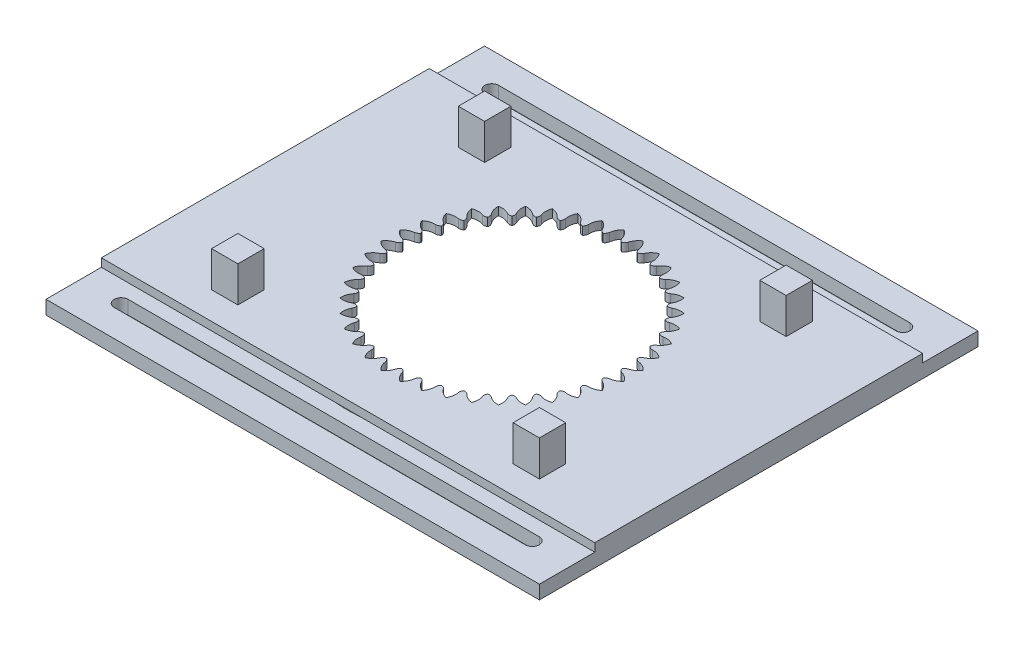
from build123d import *

# Parameters (mm, degrees)
SKETCH1_W                = 228.6
SKETCH1_H                = 203.2
BOSS_EXTRUDE1_DEPTH      = 10.16
SKETCH3_W                = 12.192
SKETCH3_H                = 12.192
BOSS_EXTRUDE2_DEPTH      = 16.51
SKETCH4_R                = 56.67375
CUT_EXTRUDE3_DEPTH       = 154.816871961
BOSS_EXTRUDE3_DEPTH      = 10.16
FILLET1_R                = 2.54
CIRPATTERN3_COUNT        = 40
FILLET1_OF_CIRPATTERN3_R = 2.54
CUT_EXTRUDE4_DEPTH       = 154.816871961
SKETCH10_R               = 76.2
CUT_EXTRUDE5_DEPTH       = 6.35
SKETCH12_W               = 228.6
SKETCH12_H               = 25.654
CUT_EXTRUDE6_DEPTH       = 3.81


with BuildPart() as part:
    # Sketch1 → Boss-Extrude1 (new body)
    with BuildSketch(Plane(origin=(0, 0, 0), x_dir=(1, 0, 0), z_dir=(0, 1, 0))):
        Rectangle(SKETCH1_W, SKETCH1_H)
    extrude(amount=BOSS_EXTRUDE1_DEPTH)

    # Sketch3 → Boss-Extrude2 (add)
    with BuildSketch(Plane(origin=(0, 10.16, 0), x_dir=(1, 0, 0), z_dir=(0, 1, 0))):
        with Locations((-69.85, -57.15)):
            Rectangle(SKETCH3_W, SKETCH3_H)
        with Locations((-69.85, 57.15)):
            Rectangle(SKETCH3_W, SKETCH3_H)
        with Locations((69.85, 57.15)):
            Rectangle(SKETCH3_W, SKETCH3_H)
        with Locations((69.85, -57.15)):
            Rectangle(SKETCH3_W, SKETCH3_H)
    extrude(amount=BOSS_EXTRUDE2_DEPTH)

    # Sketch4 → Cut-Extrude3 (cut, through all)
    with BuildSketch(Plane(origin=(0, 10.16, 0), x_dir=(1, 0, 0), z_dir=(0, 1, 0))):
        with Locations(Location((0, 0, 0), (0, 0, 270))):
            Circle(SKETCH4_R)
    extrude(amount=-CUT_EXTRUDE3_DEPTH, mode=Mode.SUBTRACT)

    # Sketch6 → Boss-Extrude3 (add)
    with BuildSketch(Plane(origin=(0, 10.16, 0), x_dir=(1, 0, 0), z_dir=(0, 1, 0))):
        with BuildLine():
            ThreePointArc((-1.180629156, 50.587787481), (-2.78438225, 54.891829112), (-6.706294718, 57.282519587))
            ThreePointArc((-6.706294718, 57.282519587), (0, 57.67375), (6.706294718, 57.282519587))
            ThreePointArc((6.706294718, 57.282519587), (2.78438225, 54.891829112), (1.180629156, 50.587787481))
            ThreePointArc((1.180629156, 50.587787481), (0, 50.6015625), (-1.180629156, 50.587787481))
        make_face()
    boss_extrude3 = extrude(amount=-BOSS_EXTRUDE3_DEPTH)

    # Fillet1
    # the kernel refuses this fillet: 2.54 mm, written as the material it takes off along each edge
    with BuildSketch(Plane(origin=(1.180629156, 15.419408995, -50.587787481), x_dir=(0.15469840037733465, 0, -0.9879617426402167), z_dir=(0, -1, 0))) as fillet1_piece_1:
        with BuildLine():
            CenterArc((2.181678609, -2.517907582), FILLET1_R, 97.562365803, 72.493020651)
            ThreePointArc((-0.320158283, -2.079259471), (-0.149272304, -1.041293741), (0, 0))
            ThreePointArc((0, 0), (0.923700585, -0.061047431), (1.84740117, 0))
        make_face()
    extrude(amount=20.678817989, mode=Mode.SUBTRACT)
    with BuildSketch(Plane(origin=(-1.180629156, 15.419408995, -50.587787481), x_dir=(-0.15469840037733582, 0, -0.9879617426402166), z_dir=(0, -1, 0))) as fillet1_piece_2:
        with BuildLine():
            CenterArc((2.181678609, 2.517907582), FILLET1_R, 189.944613546, 72.493020651)
            ThreePointArc((-0.320158283, 2.079259471), (-0.149272304, 1.041293741), (0, 0))
            ThreePointArc((0, 0), (0.923700585, 0.061047431), (1.84740117, 0))
        make_face()
    extrude(amount=20.678817989, mode=Mode.SUBTRACT)

    # CirPattern3: Boss-Extrude3 ×40 about axis
    cirpattern3_axis = Axis((0, 0, 0), (0, 1, 0))
    for i in range(1, CIRPATTERN3_COUNT):
        add(boss_extrude3.rotate(cirpattern3_axis, i * 360 / CIRPATTERN3_COUNT))

    # Fillet1 of CirPattern3
    # the kernel refuses this fillet: 2.54 mm, written as the material it takes off along each edge
    with BuildSketch(Plane(origin=(-6.747579821, 15.419408995, -50.149658962), x_dir=(-0.0017574603287242576, 0, -0.999998455665404), z_dir=(0, -1, 0)), Plane(origin=(-14.509640988, 15.419408995, -48.476679402), x_dir=(-0.1581700465288128, 0, -0.9874118879075101), z_dir=(0, -1, 0)), Plane(origin=(-21.914426639, 15.419408995, -45.61004311), x_dir=(-0.31068796124707543, 0, -0.9505119624371572), z_dir=(0, -1, 0)), Plane(origin=(-28.779606377, 15.419408995, -41.620336186), x_dir=(-0.45555570724520694, 0, -0.8902072778832575), z_dir=(0, -1, 0)), Plane(origin=(-34.936136691, 15.419408995, -36.605798455), x_dir=(-0.5892061598282523, 0, -0.8079827357193), z_dir=(0, -1, 0)), Plane(origin=(-40.232423374, 15.419408995, -30.689904478), x_dir=(-0.7083484012931893, 0, -0.7058629770609752), z_dir=(0, -1, 0)), Plane(origin=(-44.53805427, 15.419408995, -24.0183232), x_dir=(-0.8100487542447273, 0, -0.5863625292824953), z_dir=(0, -1, 0)), Plane(origin=(-47.747010456, 15.419408995, -16.755331091), x_dir=(-0.8918030184690784, 0, -0.452423890007414), z_dir=(0, -1, 0)), Plane(origin=(-49.780276781, 15.419408995, -9.079767124), x_dir=(-0.951598132654188, 0, -0.30734507305154973), z_dir=(0, -1, 0)), Plane(origin=(-50.587787481, 15.419408995, -1.180629156), x_dir=(-0.9879617426402166, 0, -0.15469840037733545), z_dir=(0, -1, 0)), Plane(origin=(-50.149658962, 15.419408995, 6.747579821), x_dir=(-0.9999984556654039, 0, 0.001757460328724237), z_dir=(0, -1, 0)), Plane(origin=(-48.476679402, 15.419408995, 14.509640988), x_dir=(-0.9874118879075098, 0, 0.15817004652881428), z_dir=(0, -1, 0)), Plane(origin=(-45.61004311, 15.419408995, 21.914426639), x_dir=(-0.9505119624371574, 0, 0.31068796124707493), z_dir=(0, -1, 0)), Plane(origin=(-41.620336186, 15.419408995, 28.779606377), x_dir=(-0.8902072778832575, 0, 0.455555707245207), z_dir=(0, -1, 0)), Plane(origin=(-36.605798455, 15.419408995, 34.936136691), x_dir=(-0.8079827357193022, 0, 0.5892061598282491), z_dir=(0, -1, 0)), Plane(origin=(-30.689904478, 15.419408995, 40.232423374), x_dir=(-0.7058629770609723, 0, 0.7083484012931922), z_dir=(0, -1, 0)), Plane(origin=(-24.0183232, 15.419408995, 44.53805427), x_dir=(-0.5863625292824933, 0, 0.8100487542447288), z_dir=(0, -1, 0)), Plane(origin=(-16.755331091, 15.419408995, 47.747010456), x_dir=(-0.452423890007414, 0, 0.8918030184690784), z_dir=(0, -1, 0)), Plane(origin=(-9.079767124, 15.419408995, 49.780276781), x_dir=(-0.3073450730515485, 0, 0.9515981326541885), z_dir=(0, -1, 0)), Plane(origin=(-1.180629156, 15.419408995, 50.587787481), x_dir=(-0.15469840037733626, 0, 0.9879617426402164), z_dir=(0, -1, 0)), Plane(origin=(6.747579821, 15.419408995, 50.149658962), x_dir=(0.0017574603287247316, 0, 0.999998455665404), z_dir=(0, -1, 0)), Plane(origin=(14.509640988, 15.419408995, 48.476679402), x_dir=(0.15817004652881494, 0, 0.9874118879075097), z_dir=(0, -1, 0)), Plane(origin=(21.914426639, 15.419408995, 45.61004311), x_dir=(0.310687961247076, 0, 0.950511962437157), z_dir=(0, -1, 0)), Plane(origin=(28.779606377, 15.419408995, 41.620336186), x_dir=(0.45555570724520844, 0, 0.8902072778832567), z_dir=(0, -1, 0)), Plane(origin=(34.936136691, 15.419408995, 36.605798455), x_dir=(0.5892061598282523, 0, 0.8079827357193), z_dir=(0, -1, 0)), Plane(origin=(40.232423374, 15.419408995, 30.689904478), x_dir=(0.7083484012931912, 0, 0.7058629770609732), z_dir=(0, -1, 0)), Plane(origin=(44.53805427, 15.419408995, 24.0183232), x_dir=(0.8100487542447268, 0, 0.586362529282496), z_dir=(0, -1, 0)), Plane(origin=(47.747010456, 15.419408995, 16.755331091), x_dir=(0.8918030184690776, 0, 0.45242389000741556), z_dir=(0, -1, 0)), Plane(origin=(49.780276781, 15.419408995, 9.079767124), x_dir=(0.9515981326541886, 0, 0.30734507305154785), z_dir=(0, -1, 0)), Plane(origin=(50.587787481, 15.419408995, 1.180629156), x_dir=(0.9879617426402165, 0, 0.1546984003773363), z_dir=(0, -1, 0)), Plane(origin=(50.149658962, 15.419408995, -6.747579821), x_dir=(0.9999984556654039, 0, -0.001757460328725693), z_dir=(0, -1, 0)), Plane(origin=(48.476679402, 15.419408995, -14.509640988), x_dir=(0.98741188790751, 0, -0.15817004652881245), z_dir=(0, -1, 0)), Plane(origin=(45.61004311, 15.419408995, -21.914426639), x_dir=(0.9505119624371569, 0, -0.3106879612470766), z_dir=(0, -1, 0)), Plane(origin=(41.620336186, 15.419408995, -28.779606377), x_dir=(0.8902072778832566, 0, -0.4555557072452085), z_dir=(0, -1, 0)), Plane(origin=(36.605798455, 15.419408995, -34.936136691), x_dir=(0.8079827357193, 0, -0.5892061598282523), z_dir=(0, -1, 0)), Plane(origin=(30.689904478, 15.419408995, -40.232423374), x_dir=(0.7058629770609732, 0, -0.7083484012931912), z_dir=(0, -1, 0)), Plane(origin=(24.0183232, 15.419408995, -44.53805427), x_dir=(0.5863625292824961, 0, -0.8100487542447269), z_dir=(0, -1, 0)), Plane(origin=(16.755331091, 15.419408995, -47.747010456), x_dir=(0.4524238900074171, 0, -0.8918030184690767), z_dir=(0, -1, 0)), Plane(origin=(9.079767124, 15.419408995, -49.780276781), x_dir=(0.30734507305155107, 0, -0.9515981326541875), z_dir=(0, -1, 0))) as fillet1_of_cirpattern3_piece_1:
        with BuildLine():
            CenterArc((2.181678609, -2.517907582), FILLET1_OF_CIRPATTERN3_R, 97.562365803, 72.493020651)
            ThreePointArc((-0.320158283, -2.079259471), (-0.149272304, -1.041293741), (0, 0))
            ThreePointArc((0, 0), (0.923700585, -0.061047431), (1.84740117, 0))
        make_face()
    extrude(amount=20.678817989, mode=Mode.SUBTRACT)
    with BuildSketch(Plane(origin=(-9.079767124, 15.419408995, -49.780276781), x_dir=(0.9872870237318744, 0, -0.15894757868762094), z_dir=(0, -1, 0)), Plane(origin=(-16.755331091, 15.419408995, -47.747010456), x_dir=(0.9502670027194106, 0, -0.3114363876342456), z_dir=(0, -1, 0)), Plane(origin=(-24.0183232, 15.419408995, -44.53805427), x_dir=(0.889848254344624, 0, -0.4562565991192077), z_dir=(0, -1, 0)), Plane(origin=(-30.689904478, 15.419408995, -40.232423374), x_dir=(0.8075184887108334, 0, -0.5898422589050155), z_dir=(0, -1, 0)), Plane(origin=(-36.605798455, 15.419408995, -34.936136691), x_dir=(0.7053049378847692, 0, -0.7089040447023573), z_dir=(0, -1, 0)), Plane(origin=(-41.620336186, 15.419408995, -28.779606377), x_dir=(0.5857244387150939, 0, -0.8105102602014908), z_dir=(0, -1, 0)), Plane(origin=(-45.61004311, 15.419408995, -21.914426639), x_dir=(0.451721459956291, 0, -0.8921590231651289), z_dir=(0, -1, 0)), Plane(origin=(-48.476679402, 15.419408995, -14.509640988), x_dir=(0.3065955996757912, 0, -0.9518398700723992), z_dir=(0, -1, 0)), Plane(origin=(-50.149658962, 15.419408995, -6.747579821), x_dir=(0.15392033819881498, 0, -0.9880832604030706), z_dir=(0, -1, 0)), Plane(origin=(-50.587787481, 15.419408995, 1.180629156), x_dir=(-0.0025449528369287443, 0, -0.9999967616022852), z_dir=(0, -1, 0)), Plane(origin=(-49.780276781, 15.419408995, 9.079767124), x_dir=(-0.15894757868762113, 0, -0.9872870237318744), z_dir=(0, -1, 0)), Plane(origin=(-47.747010456, 15.419408995, 16.755331091), x_dir=(-0.3114363876342477, 0, -0.9502670027194097), z_dir=(0, -1, 0)), Plane(origin=(-44.53805427, 15.419408995, 24.0183232), x_dir=(-0.4562565991192077, 0, -0.889848254344624), z_dir=(0, -1, 0)), Plane(origin=(-40.232423374, 15.419408995, 30.689904478), x_dir=(-0.5898422589050147, 0, -0.8075184887108341), z_dir=(0, -1, 0)), Plane(origin=(-34.936136691, 15.419408995, 36.605798455), x_dir=(-0.708904044702359, 0, -0.7053049378847674), z_dir=(0, -1, 0)), Plane(origin=(-28.779606377, 15.419408995, 41.620336186), x_dir=(-0.8105102602014898, 0, -0.5857244387150953), z_dir=(0, -1, 0)), Plane(origin=(-21.914426639, 15.419408995, 45.61004311), x_dir=(-0.8921590231651275, 0, -0.4517214599562937), z_dir=(0, -1, 0)), Plane(origin=(-14.509640988, 15.419408995, 48.476679402), x_dir=(-0.9518398700723981, 0, -0.3065955996757945), z_dir=(0, -1, 0)), Plane(origin=(-6.747579821, 15.419408995, 50.149658962), x_dir=(-0.9880832604030708, 0, -0.15392033819881487), z_dir=(0, -1, 0)), Plane(origin=(1.180629156, 15.419408995, 50.587787481), x_dir=(-0.9999967616022855, 0, 0.0025449528369287434), z_dir=(0, -1, 0)), Plane(origin=(9.079767124, 15.419408995, 49.780276781), x_dir=(-0.9872870237318744, 0, 0.158947578687621), z_dir=(0, -1, 0)), Plane(origin=(16.755331091, 15.419408995, 47.747010456), x_dir=(-0.9502670027194102, 0, 0.311436387634246), z_dir=(0, -1, 0)), Plane(origin=(24.0183232, 15.419408995, 44.53805427), x_dir=(-0.8898482543446238, 0, 0.4562565991192082), z_dir=(0, -1, 0)), Plane(origin=(30.689904478, 15.419408995, 40.232423374), x_dir=(-0.8075184887108331, 0, 0.5898422589050161), z_dir=(0, -1, 0)), Plane(origin=(36.605798455, 15.419408995, 34.936136691), x_dir=(-0.7053049378847673, 0, 0.708904044702359), z_dir=(0, -1, 0)), Plane(origin=(41.620336186, 15.419408995, 28.779606377), x_dir=(-0.5857244387150936, 0, 0.810510260201491), z_dir=(0, -1, 0)), Plane(origin=(45.61004311, 15.419408995, 21.914426639), x_dir=(-0.451721459956291, 0, 0.8921590231651289), z_dir=(0, -1, 0)), Plane(origin=(48.476679402, 15.419408995, 14.509640988), x_dir=(-0.3065955996757912, 0, 0.9518398700723992), z_dir=(0, -1, 0)), Plane(origin=(50.149658962, 15.419408995, 6.747579821), x_dir=(-0.15392033819881487, 0, 0.9880832604030708), z_dir=(0, -1, 0)), Plane(origin=(50.587787481, 15.419408995, -1.180629156), x_dir=(0.0025449528369287434, 0, 0.9999967616022855), z_dir=(0, -1, 0)), Plane(origin=(49.780276781, 15.419408995, -9.079767124), x_dir=(0.15894757868762102, 0, 0.9872870237318742), z_dir=(0, -1, 0)), Plane(origin=(47.747010456, 15.419408995, -16.755331091), x_dir=(0.31143638763424525, 0, 0.9502670027194103), z_dir=(0, -1, 0)), Plane(origin=(44.53805427, 15.419408995, -24.0183232), x_dir=(0.456256599119207, 0, 0.8898482543446244), z_dir=(0, -1, 0)), Plane(origin=(40.232423374, 15.419408995, -30.689904478), x_dir=(0.5898422589050192, 0, 0.8075184887108309), z_dir=(0, -1, 0)), Plane(origin=(34.936136691, 15.419408995, -36.605798455), x_dir=(0.7089040447023557, 0, 0.7053049378847709), z_dir=(0, -1, 0)), Plane(origin=(28.779606377, 15.419408995, -41.620336186), x_dir=(0.8105102602014924, 0, 0.5857244387150914), z_dir=(0, -1, 0)), Plane(origin=(21.914426639, 15.419408995, -45.61004311), x_dir=(0.8921590231651289, 0, 0.451721459956291), z_dir=(0, -1, 0)), Plane(origin=(14.509640988, 15.419408995, -48.476679402), x_dir=(0.9518398700723992, 0, 0.3065955996757912), z_dir=(0, -1, 0))) as fillet1_of_cirpattern3_piece_2:
        with BuildLine():
            CenterArc((2.156563939, -2.539451146), FILLET1_OF_CIRPATTERN3_R, 91.191123871, 72.493020651)
            ThreePointArc((-0.28114413, -1.825883091), (-0.080235699, -0.922231962), (0, 0))
            ThreePointArc((0, 0), (1.051881799, -0.010934197), (2.103763598, 0))
        make_face()
    extrude(amount=20.678817989, mode=Mode.SUBTRACT)
    with BuildSketch(Plane(origin=(6.747579821, 15.419408995, -50.149658962), x_dir=(0.0017574603287247384, 0, -0.999998455665404), z_dir=(0, -1, 0))) as fillet1_of_cirpattern3_piece_3:
        with BuildLine():
            CenterArc((2.181678609, 2.517907582), FILLET1_OF_CIRPATTERN3_R, 189.944613546, 72.493020651)
            ThreePointArc((-0.320158283, 2.079259471), (-0.149272304, 1.041293741), (0, 0))
            ThreePointArc((0, 0), (0.923700585, 0.061047431), (1.84740117, 0))
        make_face()
    extrude(amount=20.678817989, mode=Mode.SUBTRACT)

    # Sketch9 → Cut-Extrude4 (cut, through all)
    with BuildSketch(Plane(origin=(0, 10.16, 0), x_dir=(1, 0, 0), z_dir=(0, 1, 0))):
        with BuildLine():
            Line((-95.25, 89.0905), (95.25, 89.0905))
            ThreePointArc((95.25, 89.0905), (98.4885, 85.852), (95.25, 82.6135))
            Line((95.25, 82.6135), (-95.25, 82.6135))
            ThreePointArc((-95.25, 82.6135), (-98.4885, 85.852), (-95.25, 89.0905))
        make_face()
        with BuildLine():
            Line((-95.25, -89.0905), (95.25, -89.0905))
            ThreePointArc((95.25, -89.0905), (98.4885, -85.852), (95.25, -82.6135))
            Line((95.25, -82.6135), (-95.25, -82.6135))
            ThreePointArc((-95.25, -82.6135), (-98.4885, -85.852), (-95.25, -89.0905))
        make_face()
    extrude(amount=-CUT_EXTRUDE4_DEPTH, mode=Mode.SUBTRACT)

    # Sketch10 → Cut-Extrude5 (cut)
    with BuildSketch(Plane.XZ):
        with Locations(Location((0, 0, 0), (0, 0, 270))):
            Circle(SKETCH10_R)
    extrude(amount=-CUT_EXTRUDE5_DEPTH, mode=Mode.SUBTRACT)

    # Sketch12 → Cut-Extrude6 (cut)
    with BuildSketch(Plane(origin=(0, 10.16, 0), x_dir=(1, 0, 0), z_dir=(0, 1, 0))):
        with Locations((0, -88.773)):
            Rectangle(SKETCH12_W, SKETCH12_H)
        with Locations((0, 88.773)):
            Rectangle(SKETCH12_W, SKETCH12_H)
    extrude(amount=-CUT_EXTRUDE6_DEPTH, mode=Mode.SUBTRACT)


solid = part.part
